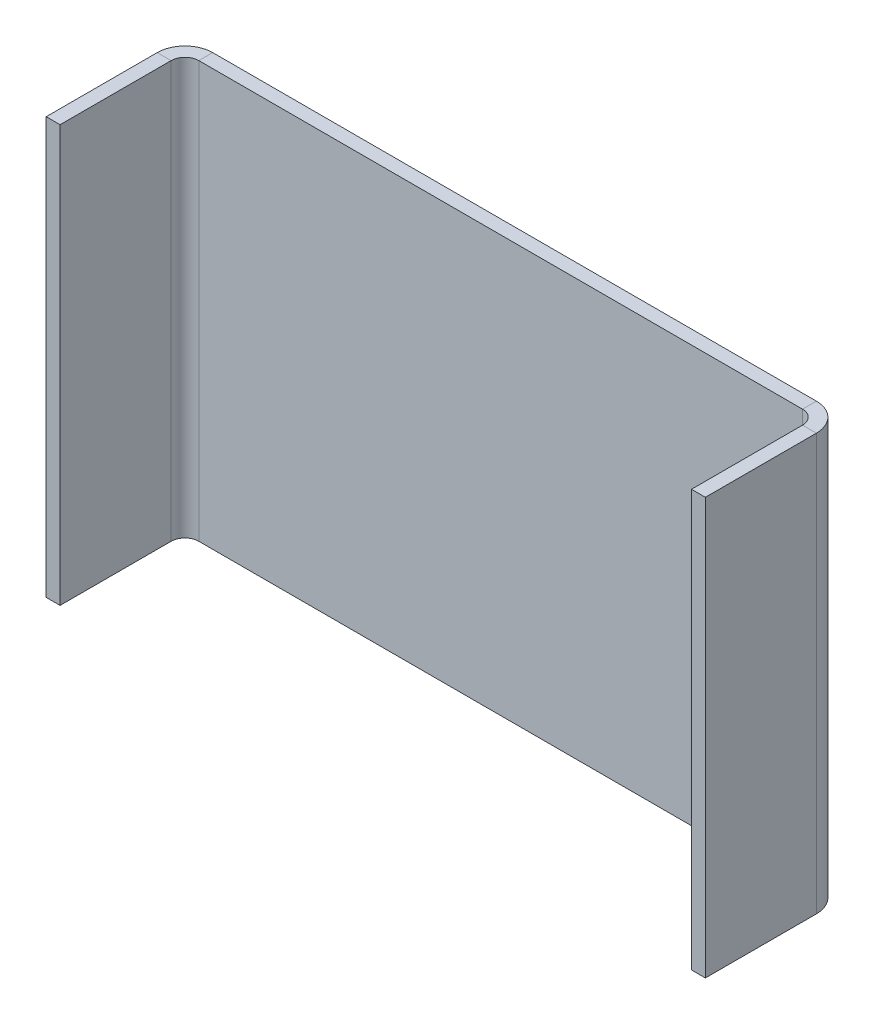
from build123d import *

# Parameters (mm, degrees)
SZKIC1_W                    = 95
SZKIC1_H                    = 60
DODANIE_WYCI_GNI_CIE1_DEPTH = 20
KONWERTUJ_BRY_1_DEPTH       = 60


# Read off the part's stored shape, not the designer's step: Konwertuj bryłę1
with BuildPart() as part:
    # Szkic1 → Dodanie-wyciągnięcie1 (new body)
    with BuildSketch(Plane.XY):
        with Locations((47.5, 30)):
            Rectangle(SZKIC1_W, SZKIC1_H)
    extrude(amount=DODANIE_WYCI_GNI_CIE1_DEPTH)

    # Konwertuj bryłę1 outline → Konwertuj bryłę1 (cut)
    with BuildSketch(Plane(origin=(0, 0, 0), x_dir=(1, 0, 0), z_dir=(0, 1, 0))):
        with BuildLine():
            Line((95, 0), (91, 0))
            ThreePointArc((91, 0), (93.828427125, -1.171572875), (95, -4))
            Line((95, -4), (95, 0))
        make_face()
        with BuildLine():
            ThreePointArc((0, -4), (1.171572875, -1.171572875), (4, 0))
            Line((4, 0), (0, 0))
            Line((0, 0), (0, -4))
        make_face()
        with BuildLine():
            Line((2, -20), (93, -20))
            Line((93, -20), (93, -4))
            ThreePointArc((93, -4), (92.414213562, -2.585786438), (91, -2))
            Line((91, -2), (4, -2))
            ThreePointArc((4, -2), (2.585786438, -2.585786438), (2, -4))
            Line((2, -4), (2, -20))
        make_face()
    extrude(amount=KONWERTUJ_BRY_1_DEPTH, mode=Mode.SUBTRACT)


solid = part.part
